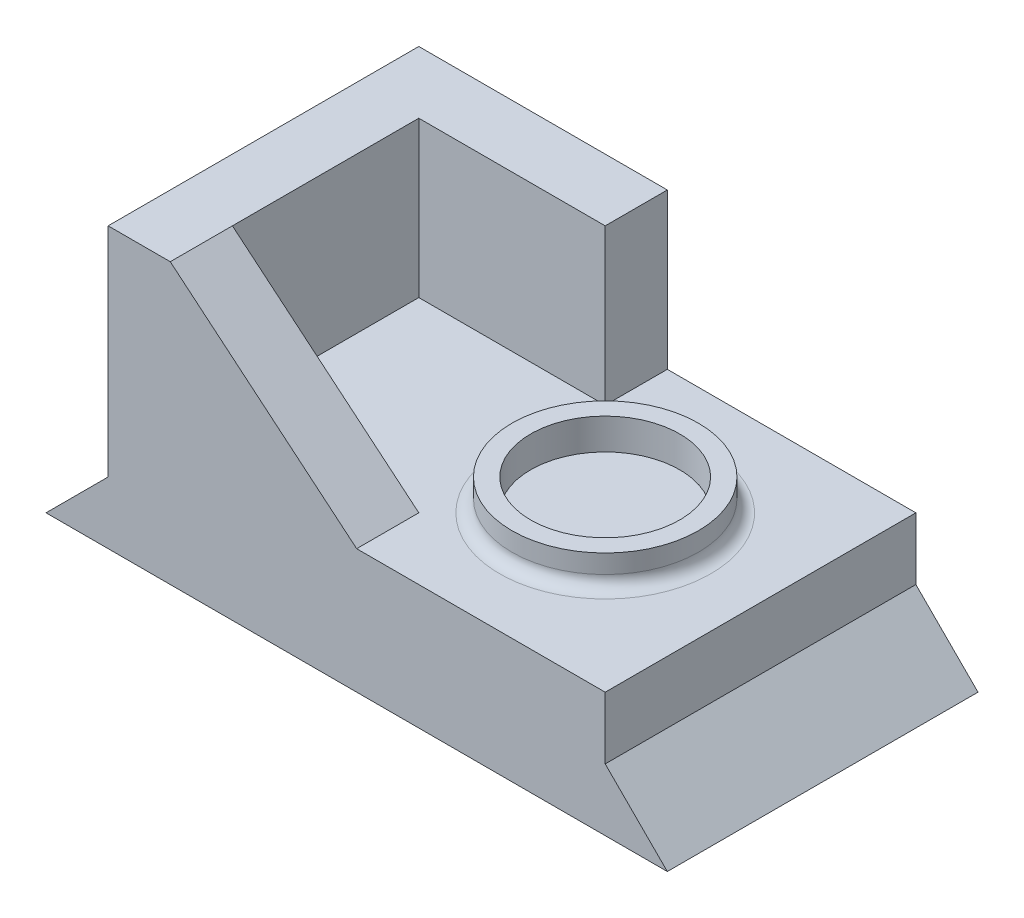
from build123d import *

# Parameters (mm, degrees)
BOSS_EXTRU_1_DEPTH      = 50
BOSS_EXTRU_2_DEPTH      = 25
ENL_V_MAT_EXTRU_1_REACH = 85.815
ESQUISSE4_R             = 15
ESQUISSE4_R_2           = 12
BOSS_EXTRU_3_DEPTH      = 5
CONG_1_R                = 2


with BuildPart() as part:
    # Esquisse1 → Boss.-Extru.1 (new body)
    with BuildSketch(Plane.XY):
        Polygon((50, 0), (-50, 0), (-40, 10), (-40, 20), (40, 20), (40, 10), align=None)
    extrude(amount=BOSS_EXTRU_1_DEPTH)

    # Esquisse2 → Boss.-Extru.2 (add)
    with BuildSketch(Plane(origin=(0, 20, 0), x_dir=(1, 0, 0), z_dir=(0, 1, 0))):
        Polygon((-40, -50), (-40, 0), (0, 0), (0, -10), (-30, -10), (-30, -40), (0, -40), (0, -50), align=None)
    extrude(amount=BOSS_EXTRU_2_DEPTH)

    # Esquisse3 → Enlèv. mat.-Extru.1 (cut, up to next)
    with BuildSketch(Plane.XY.offset(50), mode=Mode.PRIVATE) as enl_v_mat_extru_1_sk1:
        Polygon((0, 45), (0, 20), (-30, 45), align=None)
    enl_v_mat_extru_1_tool1 = extrude(enl_v_mat_extru_1_sk1.sketch, amount=-ENL_V_MAT_EXTRU_1_REACH, mode=Mode.PRIVATE) & part.part
    add(enl_v_mat_extru_1_tool1.solids().sort_by_distance((-10, 36.666667, 50))[0], mode=Mode.SUBTRACT)

    # Esquisse4 → Boss.-Extru.3 (add)
    with BuildSketch(Plane(origin=(0, 20, 0), x_dir=(1, 0, 0), z_dir=(0, 1, 0))):
        with Locations((15, -25)):
            Circle(ESQUISSE4_R)
        with Locations((15, -25)):
            Circle(ESQUISSE4_R_2, mode=Mode.SUBTRACT)
    extrude(amount=BOSS_EXTRU_3_DEPTH)

    # Congé1
    cong_1_edges = [part.edges().sort_by_distance(p)[0] for p in [
        (0, 20, 25),
    ]]
    fillet(cong_1_edges, radius=CONG_1_R)


solid = part.part
